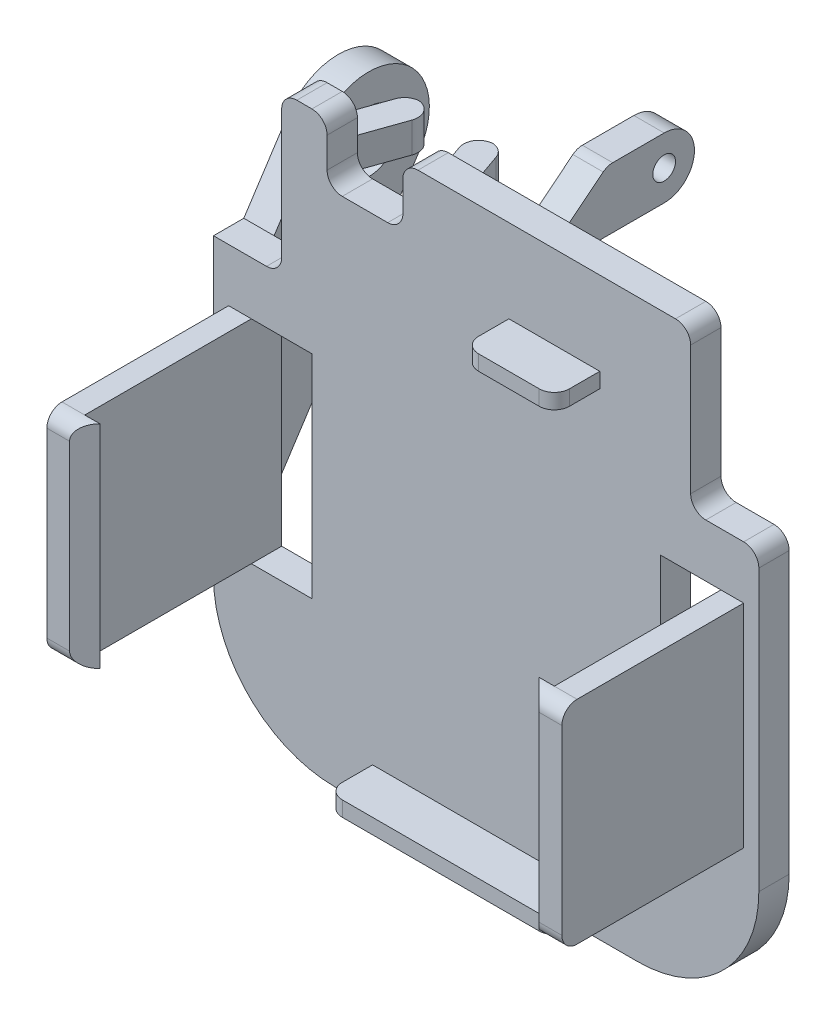
from build123d import *

# Parameters (mm, degrees)
SKETCH_1_W          = 36
SKETCH_1_H          = 38
EXTRUDE_1_DEPTH     = 2
CUT_EXTRUDE_1_REACH = 28.249
SKETCH_2_W          = 4
SKETCH_2_H          = 14
SKETCH_2_W_2        = 4.5
SKETCH_2_H_2        = 10.5
SKETCH_2_3_W        = 1.5
SKETCH_2_3_H        = 14
EXTRUDE_2_DEPTH     = 12
EXTRUDE_3_DEPTH     = 14
SKETCH_4_W          = 15
SKETCH_4_H          = 1
SKETCH_4_W_2        = 6
EXTRUDE_4_DEPTH     = 3
CUT_EXTRUDE_2_REACH = 30.792
SKETCH_5_W          = 5
SKETCH_5_H          = 4
SKETCH_6_R          = 0.75
EXTRUDE_5_DEPTH     = 2
SKETCH_7_R          = 2
EXTRUDE_6_DEPTH     = 2
EXTRUDE_7_DEPTH     = 2
FILLET_1_R          = 8
FILLET_2_R          = 1


with BuildPart() as part:
    # 草图1 → 凸台-拉伸1 (new body)
    with BuildSketch(Plane.XY):
        Rectangle(SKETCH_1_W, SKETCH_1_H)
    extrude(amount=EXTRUDE_1_DEPTH)

    # 草图2 → 切除-拉伸1 (cut, up to next)
    with BuildSketch(Plane.XY.offset(2), mode=Mode.PRIVATE) as cut_extrude_1_sk1:
        with Locations((13.5, -2)):
            Rectangle(SKETCH_2_W, SKETCH_2_H)
    cut_extrude_1_tool1 = extrude(cut_extrude_1_sk1.sketch, amount=-CUT_EXTRUDE_1_REACH, mode=Mode.PRIVATE) & part.part
    # 草图2 → 切除-拉伸1 (cut, up to next)
    with BuildSketch(Plane.XY.offset(2), mode=Mode.PRIVATE) as cut_extrude_1_sk2:
        with Locations((15.75, 13.75)):
            Rectangle(SKETCH_2_W_2, SKETCH_2_H_2)
    cut_extrude_1_tool2 = extrude(cut_extrude_1_sk2.sketch, amount=-CUT_EXTRUDE_1_REACH, mode=Mode.PRIVATE) & part.part
    cut_extrude_1_1 = cut_extrude_1_tool1.solids().sort_by_distance((13.5, -2, 2))[0]
    add(cut_extrude_1_1, mode=Mode.SUBTRACT)
    cut_extrude_1_2 = cut_extrude_1_tool2.solids().sort_by_distance((15.75, 13.75, 2))[0]
    add(cut_extrude_1_2, mode=Mode.SUBTRACT)
    cut_extrude_1 = cut_extrude_1_1 + cut_extrude_1_2  # 切除-拉伸1 as one shape, for the pattern or mirror that repeats it

    # 草图2<3> → 凸台-拉伸2 (add)
    with BuildSketch(Plane.XY.offset(2)):
        with Locations((16.25, -2)):
            Rectangle(SKETCH_2_3_W, SKETCH_2_3_H)
    extrude_2 = extrude(amount=EXTRUDE_2_DEPTH)

    # 草图3 → 凸台-拉伸3 (add)
    with BuildSketch(Plane(origin=(0, 5, 0), x_dir=(1, 0, 0), z_dir=(0, 1, 0))):
        Polygon((15.5, -14), (14.5, -13), (15.5, -13), align=None)
    extrude_3 = extrude(amount=-EXTRUDE_3_DEPTH)

    # 镜向1: 切除-拉伸1, 凸台-拉伸2, 凸台-拉伸3 across plane
    add(cut_extrude_1.mirror(Plane(origin=(0, 0, 0), x_dir=(0, 0, 1), z_dir=(1, 0, 0))), mode=Mode.SUBTRACT)
    add(extrude_2.mirror(Plane(origin=(0, 0, 0), x_dir=(0, 0, 1), z_dir=(1, 0, 0))))
    add(extrude_3.mirror(Plane(origin=(0, 0, 0), x_dir=(0, 0, 1), z_dir=(1, 0, 0))))

    # 草图4 → 凸台-拉伸4 (add)
    with BuildSketch(Plane.XY.offset(2)):
        with Locations((0, -17)):
            Rectangle(SKETCH_4_W, SKETCH_4_H)
        with Locations((4.5, 13)):
            Rectangle(SKETCH_4_W_2, SKETCH_4_H)
    extrude(amount=EXTRUDE_4_DEPTH)

    # 草图5 → 切除-拉伸2 (cut, up to next)
    with BuildSketch(Plane.XY.offset(2), mode=Mode.PRIVATE) as cut_extrude_2_sk1:
        with Locations((-8, 17)):
            Rectangle(SKETCH_5_W, SKETCH_5_H)
    cut_extrude_2_tool1 = extrude(cut_extrude_2_sk1.sketch, amount=-CUT_EXTRUDE_2_REACH, mode=Mode.PRIVATE) & part.part
    add(cut_extrude_2_tool1.solids().sort_by_distance((-8, 17, 2))[0], mode=Mode.SUBTRACT)

    # 草图6 → 凸台-拉伸5 (add)
    # profile 1 of 2: a face of its own
    with BuildSketch(Plane(origin=(3.5, 0, 0), x_dir=(0, 0, -1), z_dir=(1, 0, 0))):
        with BuildLine():
            Line((2.5, 21), (0, 19))
            Line((0, 19), (0, 17))
            Line((0, 17), (6.25, 17))
            ThreePointArc((6.25, 17), (8.25, 19), (6.25, 21))
            Line((6.25, 21), (2.5, 21))
        make_face()
        with Locations((6.25, 19)):
            Circle(SKETCH_6_R, mode=Mode.SUBTRACT)
    # profile 2 of 2: a face of its own
    with BuildSketch(Plane(origin=(3.5, 0, 0), x_dir=(0, 0, -1), z_dir=(1, 0, 0))):
        with BuildLine():
            ThreePointArc((7.423710101, -10.619384019), (8.152467876, -8.383059175), (6.25, -7))
            Line((6.25, -7), (0, -7))
            Line((0, -7), (0, -16))
            Line((0, -16), (7.423710101, -10.619384019))
        make_face()
        with Locations(Location((6.25, -9, 0), (0, 0, 180))):
            Circle(SKETCH_6_R, mode=Mode.SUBTRACT)
    extrude(amount=-EXTRUDE_5_DEPTH)

    # 草图7 → 凸台-拉伸6 (add)
    with BuildSketch(Plane.ZY.offset(18)):
        with BuildLine():
            Line((0, -6.119622458), (0, 8.5))
            Line((0, 8.5), (-2.902017955, 12.938839014))
            ThreePointArc((-2.902017955, 12.938839014), (-8.438839014, 14.097982045), (-9.597982045, 8.561160986))
            Line((-9.597982045, 8.561160986), (0, -6.119622458))
        make_face()
        with Locations(Location((-6.25, 10.75, 0), (0, 0, 270))):
            Circle(SKETCH_7_R, mode=Mode.SUBTRACT)
    extrude(amount=-EXTRUDE_6_DEPTH)

    # 草图8 → 凸台-拉伸7 (add)
    with BuildSketch(Plane(origin=(0, 15, 0), x_dir=(1, 0, 0), z_dir=(0, 1, 0))):
        Polygon((-10.5, 0), (-12.5, 0), (-11.09431212, 4), (-9.09431212, 4), align=None)
        Polygon((-4.90568788, 4), (-6.90568788, 4), (-5.5, 0), (-3.5, 0), align=None)
    extrude(amount=EXTRUDE_7_DEPTH)

    # 圆角1
    fillet_1_edges = [part.edges().sort_by_distance(p)[0] for p in [
        (18, -19, 1),
        (-18, -19, 1),
    ]]
    fillet(fillet_1_edges, radius=FILLET_1_R)

    # 圆角2
    # the kernel refuses this fillet: 1 mm, written as the material it adds along each edge
    with BuildSketch(Plane(origin=(-13.5, 8.5, 2), x_dir=(-1, 0, 0), z_dir=(0, 0, -1)), Plane(origin=(-10.5, 15, 2), x_dir=(0, 1, 0), z_dir=(0, 0, -1)), Plane(origin=(-5.5, 15, 2), x_dir=(-1, 0, 0), z_dir=(0, 0, -1))) as fillet_2_piece_1:
        with BuildLine():
            CenterArc((FILLET_2_R, FILLET_2_R), FILLET_2_R, 180, 90)
            Line((0, FILLET_2_R), (0, 0))
            Line((0, 0), (FILLET_2_R, 0))
        make_face()
    extrude(amount=2)
    with BuildSketch(Plane(origin=(-12.5, 15, 0), x_dir=(-1, 0, 0), z_dir=(0, 1, 0))) as fillet_2_piece_2:
        with BuildLine():
            CenterArc((FILLET_2_R * 0.708529633191, -FILLET_2_R), FILLET_2_R, 90, 70.63740436)
            Line((-FILLET_2_R * 0.234909668247, -FILLET_2_R * 0.668454702186), (0, 0))
            Line((0, 0), (FILLET_2_R * 0.708529633191, 0))
        make_face()
    extrude(amount=2)
    with BuildSketch(Plane(origin=(-3.5, 15, 0), x_dir=(1, 0, 0), z_dir=(0, 1, 0))) as fillet_2_piece_3:
        with BuildLine():
            CenterArc((FILLET_2_R * 0.708529633191, FILLET_2_R), FILLET_2_R, 199.36259564, 70.63740436)
            Line((-FILLET_2_R * 0.234909668247, FILLET_2_R * 0.668454702186), (0, 0))
            Line((0, 0), (FILLET_2_R * 0.708529633191, 0))
        make_face()
    extrude(amount=2)
    with BuildSketch(Plane(origin=(13.5, 8.5, 2), x_dir=(1, 0, 0), z_dir=(0, 0, -1))) as fillet_2_piece_4:
        with BuildLine():
            CenterArc((FILLET_2_R, -FILLET_2_R), FILLET_2_R, 90, 90)
            Line((0, -FILLET_2_R), (0, 0))
            Line((0, 0), (FILLET_2_R, 0))
        make_face()
    extrude(amount=2)
    # the kernel refuses this fillet: 1 mm, written as the material it takes off along each edge
    with BuildSketch(Plane(origin=(19.5, -9, 14), x_dir=(0, 1, 0), z_dir=(-1, 0, 0)), Plane(origin=(13, 5, 14), x_dir=(0, -1, 0), z_dir=(1, 0, 0)), Plane(origin=(-19.5, -9, 14), x_dir=(0, 0, -1), z_dir=(1, 0, 0))) as fillet_2_2_piece_1:
        with BuildLine():
            CenterArc((FILLET_2_R, FILLET_2_R), FILLET_2_R, 180, 90)
            Line((0, FILLET_2_R), (0, 0))
            Line((0, 0), (FILLET_2_R, 0))
        make_face()
    extrude(amount=6.5, mode=Mode.SUBTRACT)
    with BuildSketch(Plane(origin=(-13, 5, 14), x_dir=(0, -1, 0), z_dir=(-1, 0, 0))) as fillet_2_2_piece_2:
        with BuildLine():
            CenterArc((FILLET_2_R, -FILLET_2_R), FILLET_2_R, 90, 90)
            Line((0, -FILLET_2_R), (0, 0))
            Line((0, 0), (FILLET_2_R, 0))
        make_face()
    extrude(amount=6.5, mode=Mode.SUBTRACT)
    with BuildSketch(Plane(origin=(-7.5, -20, 5), x_dir=(1, 0, 0), z_dir=(0, 1, 0)), Plane(origin=(1.5, 16, 5), x_dir=(0, 0, -1), z_dir=(0, -1, 0))) as fillet_2_2_piece_3:
        with BuildLine():
            CenterArc((FILLET_2_R, FILLET_2_R), FILLET_2_R, 180, 90)
            Line((0, FILLET_2_R), (0, 0))
            Line((0, 0), (FILLET_2_R, 0))
        make_face()
    extrude(amount=6, mode=Mode.SUBTRACT)
    with BuildSketch(Plane(origin=(7.5, -14, 5), x_dir=(0, 0, -1), z_dir=(0, -1, 0)), Plane(origin=(7.5, 10, 5), x_dir=(-1, 0, 0), z_dir=(0, 1, 0))) as fillet_2_2_piece_4:
        with BuildLine():
            CenterArc((FILLET_2_R, -FILLET_2_R), FILLET_2_R, 90, 90)
            Line((0, -FILLET_2_R), (0, 0))
            Line((0, 0), (FILLET_2_R, 0))
        make_face()
    extrude(amount=6, mode=Mode.SUBTRACT)
    with BuildSketch(Plane(origin=(-13.5, 19, 4.5), x_dir=(1, 0, 0), z_dir=(0, 0, -1)), Plane(origin=(-10.5, 19, 4.5), x_dir=(0, -1, 0), z_dir=(0, 0, -1)), Plane(origin=(-5.5, 19, 4.5), x_dir=(1, 0, 0), z_dir=(0, 0, -1)), Plane(origin=(18, 8.5, 4.5), x_dir=(0, -1, 0), z_dir=(0, 0, -1)), Plane(origin=(13.5, 19, 4.5), x_dir=(0, -1, 0), z_dir=(0, 0, -1))) as fillet_2_2_piece_5:
        with BuildLine():
            CenterArc((FILLET_2_R, FILLET_2_R), FILLET_2_R, 180, 90)
            Line((0, FILLET_2_R), (0, 0))
            Line((0, 0), (FILLET_2_R, 0))
        make_face()
    extrude(amount=7, mode=Mode.SUBTRACT)
    with BuildSketch(Plane(origin=(-4.90568788, 13.228675917, -4), x_dir=(0.33154529781413966, 0, 0.9434393014377414), z_dir=(0, 1, 0)), Plane(origin=(-11.09431212, 13.228675917, -4), x_dir=(1, 0, 0), z_dir=(0, 1, 0))) as fillet_2_2_piece_6:
        with BuildLine():
            CenterArc((FILLET_2_R * 0.708529633191, -FILLET_2_R), FILLET_2_R, 90, 70.63740436)
            Line((-FILLET_2_R * 0.234909668247, -FILLET_2_R * 0.668454702186), (0, 0))
            Line((0, 0), (FILLET_2_R * 0.708529633191, 0))
        make_face()
    extrude(amount=5.542648166, mode=Mode.SUBTRACT)
    with BuildSketch(Plane(origin=(-9.09431212, 11.471566067, -4), x_dir=(-0.33154529781413894, 0, 0.9434393014377417), z_dir=(0, 1, 0)), Plane(origin=(-6.90568788, 11.471566067, -4), x_dir=(1, 0, 0), z_dir=(0, 1, 0))) as fillet_2_2_piece_7:
        with BuildLine():
            CenterArc((FILLET_2_R * 1.41137357304, -FILLET_2_R), FILLET_2_R, 90, 109.36259564)
            Line((FILLET_2_R * 0.4679342716, -FILLET_2_R * 1.33154529781), (0, 0))
            Line((0, 0), (FILLET_2_R * 1.41137357304, 0))
        make_face()
    extrude(amount=9.056867865, mode=Mode.SUBTRACT)
    with BuildSketch(Plane(origin=(4.376952648, 21, -2.5), x_dir=(0, -0.6246950475544217, 0.7808688094430323), z_dir=(-1, 0, 0))) as fillet_2_2_piece_8:
        with BuildLine():
            CenterArc((FILLET_2_R * 0.350781059358, -FILLET_2_R), FILLET_2_R, 90, 38.659808254)
            Line((-FILLET_2_R * 0.273913988196, -FILLET_2_R * 0.219131190557), (0, 0))
            Line((0, 0), (FILLET_2_R * 0.350781059358, 0))
        make_face()
    extrude(amount=3.753905297, mode=Mode.SUBTRACT)


solid = part.part
